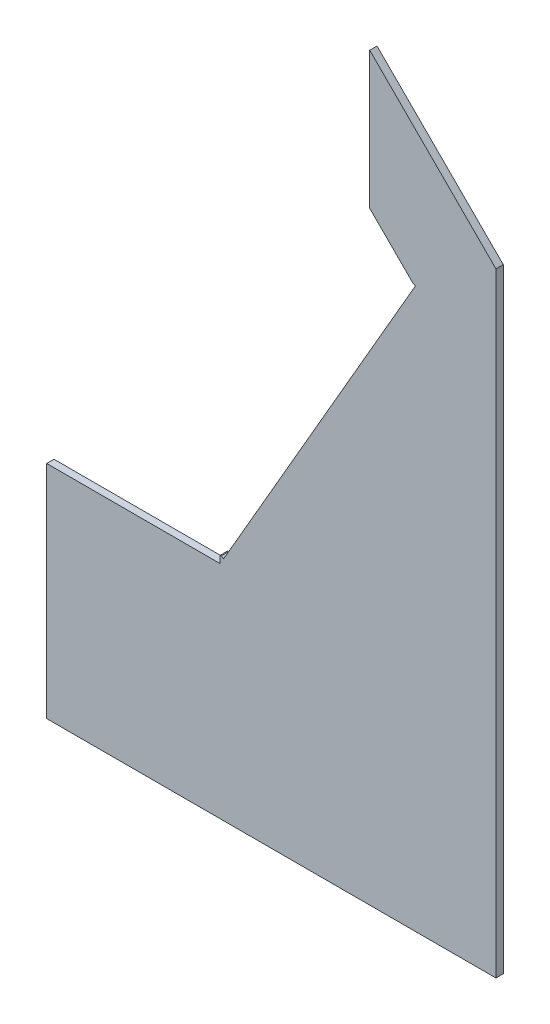
from build123d import *

# Parameters (mm, degrees)
BOSS_EXTRUDE1_DEPTH = 8


with BuildPart() as part:
    # Sketch1 → Boss-Extrude1 (new body)
    with BuildSketch(Plane.XY):
        Polygon((0, 242), (0, 0), (492, 0), (492, 672.609834714), (353.752525317, 810.857309397), (353.752525317, 660.857309397), (401.053847577, 613.555987137), (401.153525404, 613.728634197), (403.751601615, 612.228634197), (193.751601615, 248.497964607), (191.15, 250), (190, 250), (190, 242), align=None)
    extrude(amount=BOSS_EXTRUDE1_DEPTH)


solid = part.part
